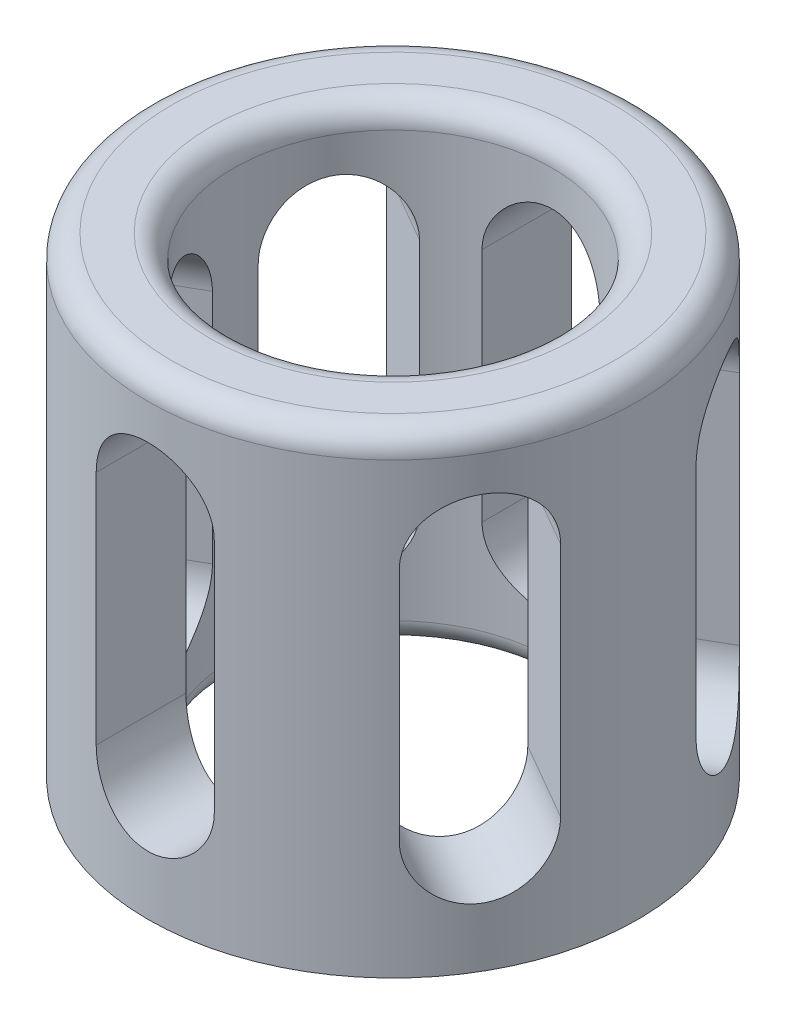
from build123d import *

# Parameters (mm, degrees)
SKETCH1_R           = 20.75
SKETCH1_R_2         = 13.5
BOSS_EXTRUDE1_DEPTH = 40
CUT_EXTRUDE1_DEPTH  = 20
CIRPATTERN1_COUNT   = 6
FILLET1_R           = 2


with BuildPart() as part:
    # Sketch1 → Boss-Extrude1 (new body)
    with BuildSketch(Plane(origin=(0, 0, 0), x_dir=(1, 0, 0), z_dir=(0, 1, 0))):
        Circle(SKETCH1_R)
        Circle(SKETCH1_R_2, mode=Mode.SUBTRACT)
    extrude(amount=BOSS_EXTRUDE1_DEPTH)

    # Sketch2 → Cut-Extrude1 (cut)
    with BuildSketch(Plane.XY.offset(20.75)):
        with BuildLine():
            ThreePointArc((5, 30), (0, 35), (-5, 30))
            Line((-5, 30), (-5, 10))
            ThreePointArc((-5, 10), (0, 5), (5, 10))
            Line((5, 10), (5, 30))
        make_face()
    cut_extrude1 = extrude(amount=-CUT_EXTRUDE1_DEPTH, mode=Mode.SUBTRACT)

    # CirPattern1: Cut-Extrude1 ×6 about axis
    cirpattern1_axis = Axis((0, 40, 0), (0, -1, 0))
    for i in range(1, CIRPATTERN1_COUNT):
        add(cut_extrude1.rotate(cirpattern1_axis, i * 360 / CIRPATTERN1_COUNT), mode=Mode.SUBTRACT)

    # Fillet1
    fillet1_edges = [part.edges().sort_by_distance(p)[0] for p in [
        (-20.75, 40, 0),
        (-13.5, 0, 0),
        (-13.5, 40, 0),
    ]]
    fillet(fillet1_edges, radius=FILLET1_R)


solid = part.part
